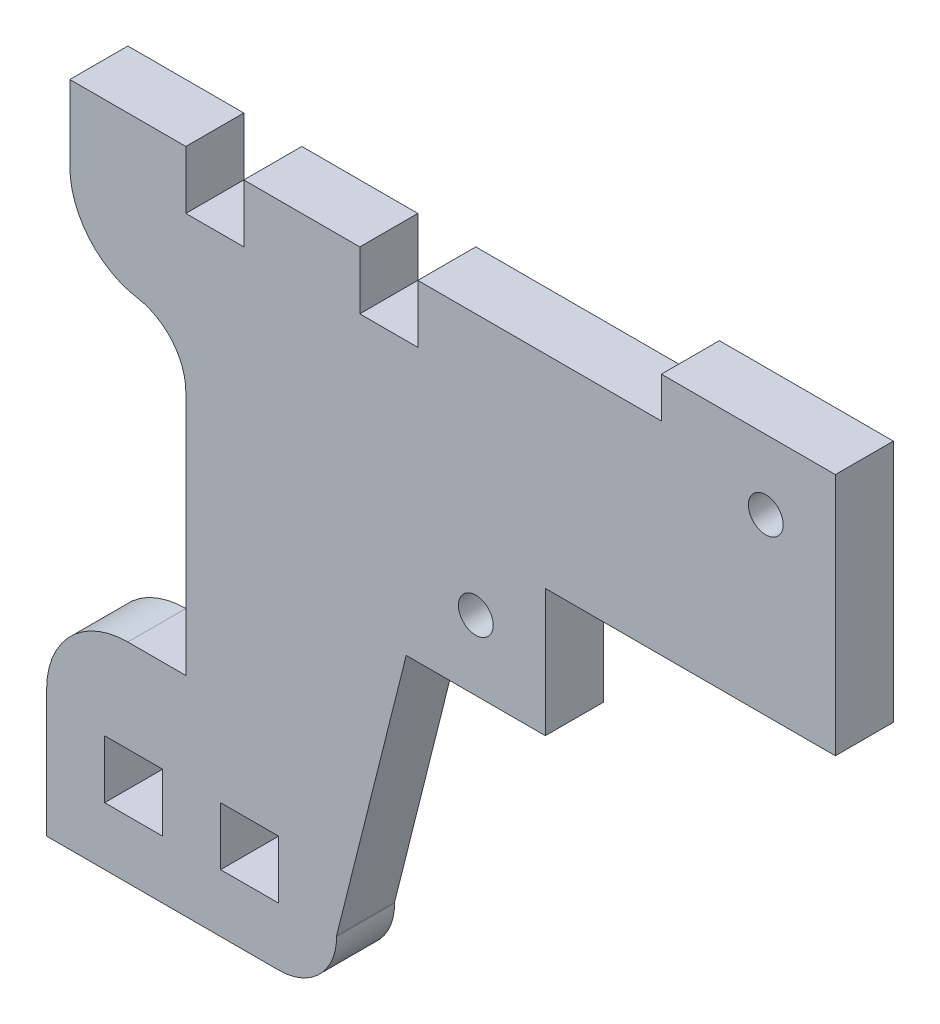
from build123d import *

# Parameters (mm, degrees)
ESQUISSE1_R        = 1.5
ESQUISSE1_W        = 5
ESQUISSE1_H        = 5
BOSS_EXTRU_1_DEPTH = 5
CONG_1_R           = 7
CONG_2_R           = 5
CONG_3_R           = 5


with BuildPart() as part:
    # Esquisse1 → Boss.-Extru.1 (new body)
    with BuildSketch(Plane.XY):
        Polygon((31, 19), (43, 19), (43, 30), (68, 30), (68, 51), (53, 51), (53, 47.5), (32, 47.5), (32, 42.5), (27, 42.5), (27, 47.5), (17, 47.5), (17, 42.5), (12, 42.5), (12, 47.5), (2, 47.5), (2, 42.5), (2, 34), (12, 34), (12, 8), (0, 8), (0, 0), (0, -5.810046935), (0, -10), (25, -10), (25, -4.928993292), align=None)
        with Locations((62, 45)):
            Circle(ESQUISSE1_R, mode=Mode.SUBTRACT)
        with Locations((37, 25)):
            Circle(ESQUISSE1_R, mode=Mode.SUBTRACT)
        with Locations((7.5, -2.5)):
            Rectangle(ESQUISSE1_W, ESQUISSE1_H, mode=Mode.SUBTRACT)
        with Locations((17.5, -2.5)):
            Rectangle(ESQUISSE1_W, ESQUISSE1_H, mode=Mode.SUBTRACT)
    extrude(amount=BOSS_EXTRU_1_DEPTH)

    # Congé1
    cong_1_edges = [part.edges().sort_by_distance(p)[0] for p in [
        (0, 8, 2.5),
        (2, 34, 2.5),
    ]]
    fillet(cong_1_edges, radius=CONG_1_R)

    # Congé2
    cong_2_edges = [part.edges().sort_by_distance(p)[0] for p in [
        (12, 34, 2.5),
    ]]
    fillet(cong_2_edges, radius=CONG_2_R)

    # Congé3
    cong_3_edges = [part.edges().sort_by_distance(p)[0] for p in [
        (25, -10, 2.5),
    ]]
    fillet(cong_3_edges, radius=CONG_3_R)


solid = part.part
